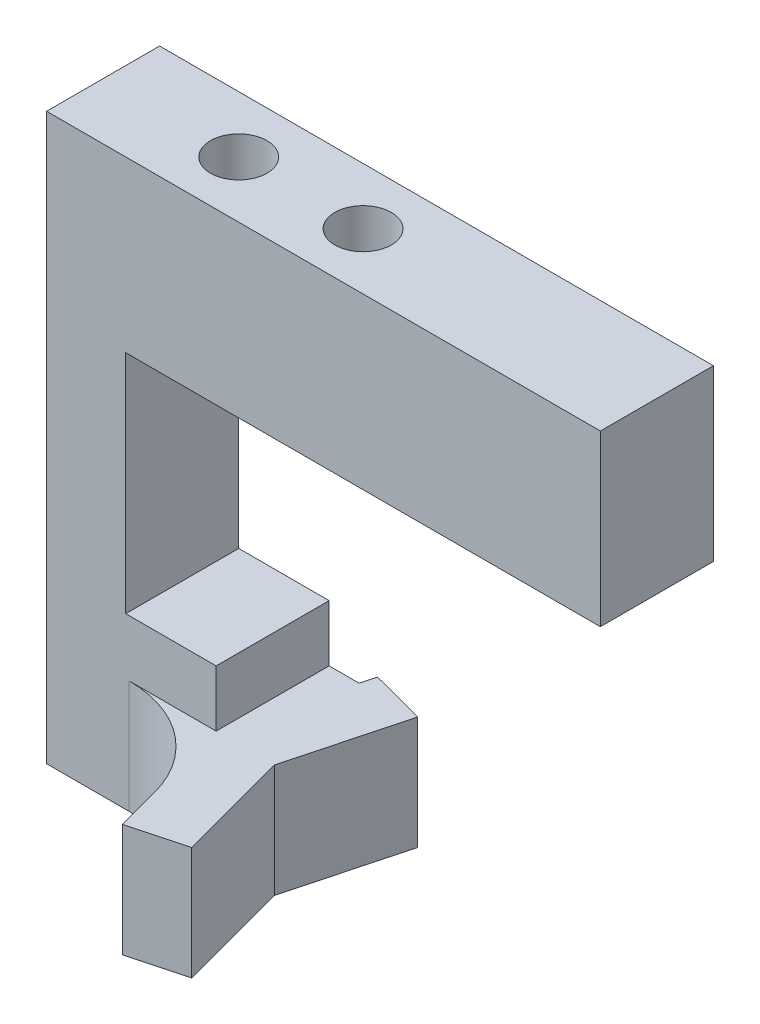
from build123d import *

# Parameters (mm, degrees)
BOSS_EXTRUDE1_DEPTH = 5
BOSS_EXTRUDE2_DEPTH = 10
FILLET1_R           = 10
SKETCH3_W           = 8
SKETCH3_H           = 20
CUT_EXTRUDE1_DEPTH  = 74.171272574
SKETCH4_R           = 2.5
CUT_EXTRUDE2_DEPTH  = 63.379394923


with BuildPart() as part:
    # Sketch1 → Boss-Extrude1 (new, symmetric)
    with BuildSketch(Plane.XY):
        Polygon((49, 0), (0, 0), (0, -50), (15, -50), (15, -15), (49, -15), align=None)
    extrude(amount=BOSS_EXTRUDE1_DEPTH, both=True)

    # Sketch2 → Boss-Extrude2 (add)
    with BuildSketch(Plane.XZ.offset(50)):
        Polygon((17.658485169, -5), (18, -6.284621916), (22.832157544, -5), (20.173672375, 5), (22.832157544, 15), (18, 16.284621916), (15, 5), (15, -5), align=None)
    extrude(amount=-BOSS_EXTRUDE2_DEPTH)

    # Fillet1
    fillet1_edges = [part.edges().sort_by_distance(p)[0] for p in [
        (15, -45, 5),
    ]]
    fillet(fillet1_edges, radius=FILLET1_R)

    # Sketch3 → Cut-Extrude1 (cut, through all)
    with BuildSketch(Plane(origin=(0, 0, -5), x_dir=(-1, 0, 0), z_dir=(0, 0, -1))):
        with Locations((-11, -25)):
            Rectangle(SKETCH3_W, SKETCH3_H)
    extrude(amount=-CUT_EXTRUDE1_DEPTH, mode=Mode.SUBTRACT)

    # Sketch4 → Cut-Extrude2 (cut, through all)
    with BuildSketch(Plane.XZ.offset(15)):
        with Locations((23, 0)):
            Circle(SKETCH4_R)
        with Locations((12, 0)):
            Circle(SKETCH4_R)
    extrude(amount=-CUT_EXTRUDE2_DEPTH, mode=Mode.SUBTRACT)


solid = part.part
